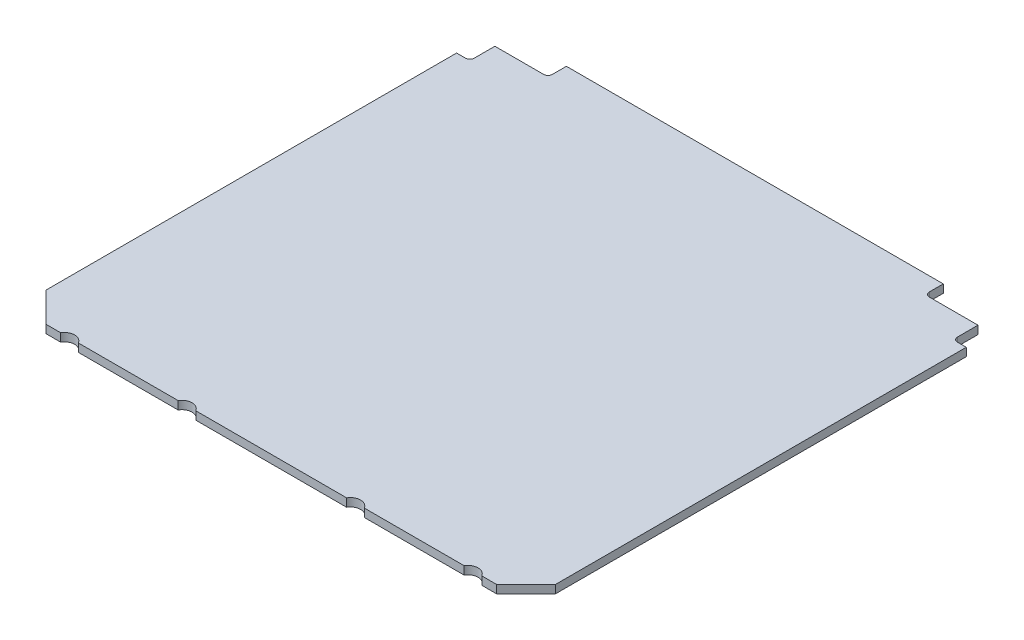
from build123d import *

# Parameters (mm, degrees)
GENERALSHAPE_DEPTH   = 0.8
ADDTOLERANCE_START   = -0.8
ADDTOLERANCE_DEPTH   = 1.6
BACKPLANE_DEPTH      = 71.573791169
BACKPLANE_DEPTH_BACK = 71.573791169
FILLET2_R            = 0.8636


# Read off the part's stored shape, not the designer's step: AddTolerance
with BuildPart() as part:
    # Sketch2 → GeneralShape (new, symmetric)
    with BuildSketch(Plane(origin=(0, 0, 0), x_dir=(1, 0, 0), z_dir=(0, 1, 0))):
        Polygon((47.4, 46.4), (37, 46.4), (37, 50), (-37, 50), (-37, 46.4), (-47.4, 46.4), (-47.4, 41.5), (-50, 41.5), (-50, -38.9), (-41.5, -47.4), (41.5, -47.4), (50, -38.9), (50, 41.5), (47.4, 41.5), align=None)
    extrude(amount=GENERALSHAPE_DEPTH, both=True)

    # AddTolerance outline → AddTolerance (cut)
    with BuildSketch(Plane(origin=(0, 0, 0), x_dir=(1, 0, 0), z_dir=(0, 1, 0)).offset(ADDTOLERANCE_START)):
        Polygon((49.9, 41.4), (49.9, -39), (50, -38.9), (50, 41.5), (47.4, 41.5), (47.4, 46.4), (37, 46.4), (37, 50), (-37, 50), (-37, 46.4), (-47.4, 46.4), (-47.4, 41.5), (-50, 41.5), (-50, -38.9), (-49.9, -39), (-49.9, 41.4), (-47.3, 41.4), (-47.3, 46.3), (-36.9, 46.3), (-36.9, 49.9), (36.9, 49.9), (36.9, 46.3), (47.3, 46.3), (47.3, 41.4), align=None)
    extrude(amount=ADDTOLERANCE_DEPTH, mode=Mode.SUBTRACT)

    # Sketch4 → Backplane (cut, two sides: drawn at the far end of the back side and taken through both)
    with BuildSketch(Plane(origin=(0, 0, 0), x_dir=(1, 0, 0), z_dir=(0, 1, 0)).offset(-BACKPLANE_DEPTH_BACK)):
        with BuildLine():
            Line((41.5, -47.4), (44.1, -44.8))
            Line((44.1, -44.8), (41.232050808, -44.8))
            ThreePointArc((41.232050808, -44.8), (39.5, -43.8), (37.767949192, -44.8))
            Line((37.767949192, -44.8), (18.232050808, -44.8))
            ThreePointArc((18.232050808, -44.8), (16.5, -43.8), (14.767949192, -44.8))
            Line((14.767949192, -44.8), (-14.767949192, -44.8))
            ThreePointArc((-14.767949192, -44.8), (-16.5, -43.8), (-18.232050808, -44.8))
            Line((-18.232050808, -44.8), (-37.767949192, -44.8))
            ThreePointArc((-37.767949192, -44.8), (-39.5, -43.8), (-41.232050808, -44.8))
            Line((-41.232050808, -44.8), (-44.1, -44.8))
            Line((-44.1, -44.8), (-41.5, -47.4))
            Line((-41.5, -47.4), (41.5, -47.4))
        make_face()
    extrude(amount=BACKPLANE_DEPTH + BACKPLANE_DEPTH_BACK, mode=Mode.SUBTRACT)

    # Fillet2
    fillet2_edges = [part.edges().sort_by_distance(p)[0] for p in [
        (47.3, 0, -41.4),
        (36.9, 0, -46.3),
        (-36.9, 0, -46.3),
        (-47.3, 0, -41.4),
    ]]
    fillet(fillet2_edges, radius=FILLET2_R)


solid = part.part
